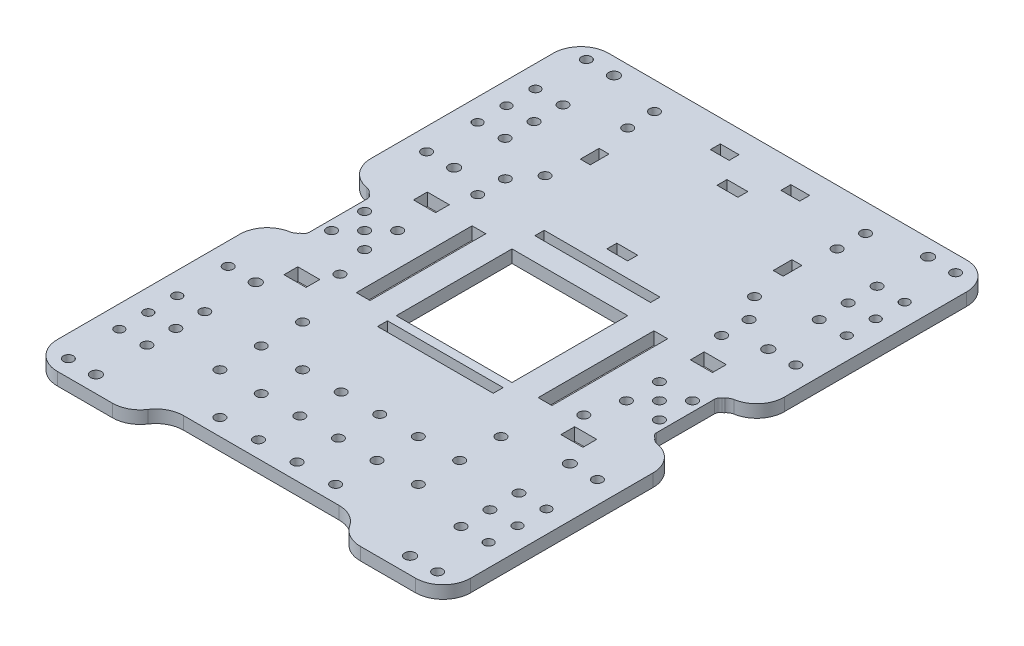
from build123d import *

# Parameters (mm, degrees)
SKETCH_2_W           = 130
SKETCH_2_H           = 200
SKETCH_2_R           = 1.8
EXTRUDE_1_DEPTH      = 4.6
FILLET_1_R           = 5
SKETCH_3_W           = 4
SKETCH_3_H           = 24
CUT_EXTRUDE_1_DEPTH  = 4.6
FILLET_2_R           = 2
FILLET_3_R           = 2
SKETCH_4_R           = 1.8
SKETCH_4_R_2         = 1.95
CUT_EXTRUDE_2_DEPTH  = 4.6
SKETCH_5_R           = 1.8
SKETCH_5_W           = 6.8
SKETCH_5_H           = 3.6
SKETCH_5_W_2         = 42
SKETCH_5_H_2         = 42
SKETCH_5_H_3         = 3.4
SKETCH_5_W_3         = 70
SKETCH_5_H_4         = 18
CUT_EXTRUDE_3_DEPTH  = 4.6
FILLET_4_R           = 10
FILLET_5_R           = 10
SKETCH_6_R           = 1.8
CUT_EXTRUDE_4_DEPTH  = 4.6
SKETCH_7_R           = 1.8
CUT_EXTRUDE_5_DEPTH  = 4.6
SKETCH_8_W           = 7.56096601
SKETCH_8_H           = 3.597038402
SKETCH_8_H_2         = 3.621629188
SKETCH_8_W_2         = 3.6
SKETCH_8_H_3         = 6.8
CUT_EXTRUDE_6_DEPTH  = 4.6
SKETCH_10_R          = 1.8
CUT_EXTRUDE_8_DEPTH  = 4.6
SKETCH_9_W           = 8
SKETCH_9_H           = 5
SKETCH_9_W_2         = 5
SKETCH_9_H_2         = 42
CUT_EXTRUDE_9_DEPTH  = 4.6
EXTRUDE_START        = 2
SKETCH_12_W          = 18.75
SKETCH_12_H          = 71.5
SKETCH_12_R          = 1.95
SKETCH_12_R_2        = 1.8
SKETCH_12_R_3        = 1.814304703
SKETCH_12_W_2        = 4
SKETCH_12_H_2        = 2
SKETCH_12_W_3        = 44.25
SKETCH_12_H_3        = 9.499668345
SKETCH_12_H_4        = 71.502072164
SKETCH_12_H_5        = 4.00066331
SKETCH_12_H_6        = 10.999668345
SKETCH_12_H_7        = 10.799999999
SKETCH_12_W_4        = 15.750000002
SKETCH_12_H_8        = 4
SKETCH_12_W_5        = 24.499999998
SKETCH_12_W_6        = 24.5
SKETCH_12_W_7        = 15.75
SKETCH_12_H_9        = 11
SKETCH_12_H_10       = 10.8
SKETCH_12_H_11       = 0.5
SKETCH_12_W_8        = 15.750000003
SKETCH_12_W_9        = 3.999999999
SKETCH_12_W_10       = 14.75
SKETCH_12_H_12       = 76.497927836
SKETCH_12_H_13       = 76.5
SKETCH_12_H_14       = 11.97
SKETCH_12_H_15       = 9.167588033
SKETCH_12_H_16       = 0.69
SKETCH_12_H_17       = 1.832411967
SKETCH_12_H_18       = 1.142411967
SKETCH_12_H_19       = 1.059701493
SKETCH_12_H_20       = 8.290597014
SKETCH_12_H_21       = 1.559701493
EXTRUDE_2_DEPTH      = 2
SKETCH_13_W          = 30
SKETCH_13_H          = 4
EXTRUDE_3_DEPTH      = 2
FILLET_6_R           = 5
SKETCH_14_W          = 42
SKETCH_14_H          = 3.4
EXTRUDE_4_DEPTH      = 4.6
SKETCH_15_W          = 42
SKETCH_15_H          = 3.6
CUT_EXTRUDE_10_DEPTH = 10
SKETCH_16_W          = 204.995685258
SKETCH_16_H          = 218.219063178
CUT_EXTRUDE_11_DEPTH = 2
SKETCH_17_W          = 15
SKETCH_17_H          = 86
EXTRUDE_5_DEPTH      = 4.6
FILLET_7_R           = 3.5
FILLET_8_R           = 10
SKETCH_18_R          = 1.7
SKETCH_18_R_2        = 1.8
CUT_EXTRUDE_12_DEPTH = 10


# Some blends are built 0.0001 mm under size
with BuildPart() as part:
    # 草图2 → 凸台-拉伸1 (new body)
    with BuildSketch(Plane(origin=(0, 0, 0), x_dir=(1, 0, 0), z_dir=(0, 1, 0))):
        Rectangle(SKETCH_2_W, SKETCH_2_H)
        with Locations(Location((-59.5, 6, 0), (0, 0, 270))):
            Circle(SKETCH_2_R, mode=Mode.SUBTRACT)
        with Locations(Location((-47.5, 6, 0), (0, 0, 270))):
            Circle(SKETCH_2_R, mode=Mode.SUBTRACT)
        with Locations(Location((-59.5, -6, 0), (0, 0, 270))):
            Circle(SKETCH_2_R, mode=Mode.SUBTRACT)
        with Locations(Location((-47.5, -6, 0), (0, 0, 270))):
            Circle(SKETCH_2_R, mode=Mode.SUBTRACT)
        with Locations(Location((-53.5, 0, 0), (0, 0, 270))):
            Circle(SKETCH_2_R, mode=Mode.SUBTRACT)
        with Locations(Location((53.5, 0, 0), (0, 0, 270))):
            Circle(SKETCH_2_R, mode=Mode.SUBTRACT)
        with Locations(Location((59.5, 6, 0), (0, 0, 270))):
            Circle(SKETCH_2_R, mode=Mode.SUBTRACT)
        with Locations(Location((59.5, -6, 0), (0, 0, 270))):
            Circle(SKETCH_2_R, mode=Mode.SUBTRACT)
        with Locations(Location((47.5, -6, 0), (0, 0, 270))):
            Circle(SKETCH_2_R, mode=Mode.SUBTRACT)
        with Locations(Location((47.5, 6, 0), (0, 0, 270))):
            Circle(SKETCH_2_R, mode=Mode.SUBTRACT)
    extrude(amount=EXTRUDE_1_DEPTH)

    # 圆角1
    fillet_1_edges = [part.edges().sort_by_distance(p)[0] for p in [
        (65, 2.3, 100),
        (-65, 2.3, 100),
        (-65, 2.3, -100),
        (65, 2.3, -100),
    ]]
    fillet(fillet_1_edges, radius=FILLET_1_R)

    # 草图3 → 切除-拉伸1 (cut)
    with BuildSketch(Plane(origin=(0, 4.6, 0), x_dir=(1, 0, 0), z_dir=(0, 1, 0))):
        with Locations((-65, 0)):
            Rectangle(SKETCH_3_W, SKETCH_3_H)
        with Locations((65, 0)):
            Rectangle(SKETCH_3_W, SKETCH_3_H)
    extrude(amount=-CUT_EXTRUDE_1_DEPTH, mode=Mode.SUBTRACT)

    # 圆角2
    fillet_2_edges = [part.edges().sort_by_distance(p)[0] for p in [
        (65, 2.3, 12),
        (65, 2.3, -12),
        (-65, 2.3, 12),
        (-65, 2.3, -12),
    ]]
    fillet(fillet_2_edges, radius=FILLET_2_R - 0.0001)  # a hair under: the kernel refuses the full size

    # 圆角3
    fillet_3_edges = [part.edges().sort_by_distance(p)[0] for p in [
        (-63, 2.3, 12),
        (-63, 2.3, -12),
        (63, 2.3, -12),
        (63, 2.3, 12),
    ]]
    fillet(fillet_3_edges, radius=FILLET_3_R)

    # 草图4 → 切除-拉伸2 (cut)
    with BuildSketch(Plane(origin=(0, 0, 0), x_dir=(1, 0, 0), z_dir=(0, 1, 0))):
        with Locations(Location((57, 65, 0), (0, 0, 270))):
            Circle(SKETCH_4_R)
        with Locations(Location((57, 75.5, 0), (0, 0, 270))):
            Circle(SKETCH_4_R)
        with Locations(Location((57, 54.5, 0), (0, 0, 270))):
            Circle(SKETCH_4_R)
        with Locations(Location((57, 94, 0), (0, 0, 270))):
            Circle(SKETCH_4_R_2)
        with Locations(Location((57, 36, 0), (0, 0, 270))):
            Circle(SKETCH_4_R_2)
        with Locations(Location((-57, 94, 0), (0, 0, 270))):
            Circle(SKETCH_4_R_2)
        with Locations(Location((-57, 75.5, 0), (0, 0, 270))):
            Circle(SKETCH_4_R)
        with Locations(Location((-57, 65, 0), (0, 0, 270))):
            Circle(SKETCH_4_R)
        with Locations(Location((-57, 54.5, 0), (0, 0, 270))):
            Circle(SKETCH_4_R)
        with Locations(Location((-57, 36, 0), (0, 0, 270))):
            Circle(SKETCH_4_R_2)
        with Locations(Location((-57, -36, 0), (0, 0, 270))):
            Circle(SKETCH_4_R_2)
        with Locations(Location((-57, -65, 0), (0, 0, 270))):
            Circle(SKETCH_4_R)
        with Locations(Location((-57, -54.5, 0), (0, 0, 270))):
            Circle(SKETCH_4_R)
        with Locations(Location((-57, -75.5, 0), (0, 0, 270))):
            Circle(SKETCH_4_R)
        with Locations(Location((-57, -94, 0), (0, 0, 270))):
            Circle(SKETCH_4_R_2)
        with Locations(Location((57, -65, 0), (0, 0, 270))):
            Circle(SKETCH_4_R)
        with Locations(Location((57, -75.5, 0), (0, 0, 270))):
            Circle(SKETCH_4_R)
        with Locations(Location((57, -54.5, 0), (0, 0, 270))):
            Circle(SKETCH_4_R)
        with Locations(Location((57, -36, 0), (0, 0, 270))):
            Circle(SKETCH_4_R_2)
        with Locations(Location((57, -94, 0), (0, 0, 270))):
            Circle(SKETCH_4_R_2)
    extrude(amount=CUT_EXTRUDE_2_DEPTH, mode=Mode.SUBTRACT)

    # 草图5 → 切除-拉伸3 (cut)
    with BuildSketch(Plane(origin=(0, 4.6, 0), x_dir=(1, 0, 0), z_dir=(0, 1, 0))):
        with Locations(Location((38.3, 90, 0), (0, 0, 270))):
            Circle(SKETCH_5_R)
        with Locations(Location((-38.3, 90, 0), (0, 0, 270))):
            Circle(SKETCH_5_R)
        with Locations((-12.8, 90)):
            Rectangle(SKETCH_5_W, SKETCH_5_H)
        with Locations((12.8, 90)):
            Rectangle(SKETCH_5_W, SKETCH_5_H)
        Rectangle(SKETCH_5_W_2, SKETCH_5_H_2)
        with Locations((0, 31)):
            Rectangle(SKETCH_5_W_2, SKETCH_5_H_3)
        with Locations((0, -31)):
            Rectangle(SKETCH_5_W_2, SKETCH_5_H_3)
        with Locations((0, -100)):
            Rectangle(SKETCH_5_W_3, SKETCH_5_H_4)
    extrude(amount=-CUT_EXTRUDE_3_DEPTH, mode=Mode.SUBTRACT)

    # 圆角4
    # the kernel refuses this fillet: 10 mm, written as the material it takes off along each edge
    with BuildSketch(Plane(origin=(-35, -24.874685928, 100), x_dir=(-1, 0, 0), z_dir=(0, 1, 0))) as fillet_4_piece_1:
        with BuildLine():
            CenterArc((9.949874371, -10), FILLET_4_R, 90, 84.260829523)
            Line((0, -9), (-0.198997487, -8.98))
            ThreePointArc((-0.198997487, -8.98), (-0.2, -4.5), (-0.2, 0))
            Line((-0.2, 0), (0, 0.2))
            Line((0, 0.2), (9.949874371, 0.2))
            Line((9.949874371, 0.2), (9.949874371, 0))
        make_face()
    extrude(amount=54.349371855, mode=Mode.SUBTRACT)
    with BuildSketch(Plane(origin=(35, 29.474685928, 100), x_dir=(0, 0, -1), z_dir=(0, -1, 0))) as fillet_4_piece_2:
        with BuildLine():
            CenterArc((10, 9.949874371), FILLET_4_R, 180, 84.260829523)
            Line((0, 9.949874371), (-0.2, 9.949874371))
            Line((-0.2, 9.949874371), (-0.2, 0))
            Line((-0.2, 0), (0, -0.2))
            ThreePointArc((0, -0.2), (4.5, -0.2), (8.98, -0.198997487))
            Line((8.98, -0.198997487), (9, 0))
        make_face()
    extrude(amount=54.349371855, mode=Mode.SUBTRACT)

    # 圆角5
    fillet_5_edges = [part.edges().sort_by_distance(p)[0] for p in [
        (35, 2.3, 91),
        (-35, 2.3, 91),
    ]]
    fillet(fillet_5_edges, radius=FILLET_5_R)

    # 草图6 → 切除-拉伸4 (cut)
    with BuildSketch(Plane(origin=(0, 4.6, 0), x_dir=(1, 0, 0), z_dir=(0, 1, 0))):
        with Locations(Location((-7, -85, 0), (0, 0, 270))):
            Circle(SKETCH_6_R)
        with Locations(Location((-21, -85, 0), (0, 0, 270))):
            Circle(SKETCH_6_R)
        with Locations(Location((7, -85, 0), (0, 0, 270))):
            Circle(SKETCH_6_R)
        with Locations(Location((21, -85, 0), (0, 0, 270))):
            Circle(SKETCH_6_R)
        with Locations(Location((21, -70, 0), (0, 0, 270))):
            Circle(SKETCH_6_R)
        with Locations(Location((7, -70, 0), (0, 0, 270))):
            Circle(SKETCH_6_R)
        with Locations(Location((-7, -70, 0), (0, 0, 270))):
            Circle(SKETCH_6_R)
        with Locations(Location((-21, -70, 0), (0, 0, 270))):
            Circle(SKETCH_6_R)
        with Locations(Location((-21, -55, 0), (0, 0, 270))):
            Circle(SKETCH_6_R)
        with Locations(Location((-7, -55, 0), (0, 0, 270))):
            Circle(SKETCH_6_R)
        with Locations(Location((7, -55, 0), (0, 0, 270))):
            Circle(SKETCH_6_R)
        with Locations(Location((21, -55, 0), (0, 0, 270))):
            Circle(SKETCH_6_R)
        with Locations(Location((36, -70, 0), (0, 0, 270))):
            Circle(SKETCH_6_R)
        with Locations(Location((36, -55, 0), (0, 0, 270))):
            Circle(SKETCH_6_R)
        with Locations(Location((36, -40, 0), (0, 0, 270))):
            Circle(SKETCH_6_R)
        with Locations(Location((-36, -40, 0), (0, 0, 270))):
            Circle(SKETCH_6_R)
        with Locations(Location((-36, -55, 0), (0, 0, 270))):
            Circle(SKETCH_6_R)
        with Locations(Location((-36, -70, 0), (0, 0, 270))):
            Circle(SKETCH_6_R)
    extrude(amount=-CUT_EXTRUDE_4_DEPTH, mode=Mode.SUBTRACT)

    # 草图7 → 切除-拉伸5 (cut)
    with BuildSketch(Plane(origin=(0, 4.6, 0), x_dir=(1, 0, 0), z_dir=(0, 1, 0))):
        with Locations(Location((-38, 80, 0), (0, 0, 270))):
            Circle(SKETCH_7_R)
        with Locations(Location((38, 80, 0), (0, 0, 270))):
            Circle(SKETCH_7_R)
        with Locations(Location((38, 50, 0), (0, 0, 270))):
            Circle(SKETCH_7_R)
        with Locations(Location((-38, 50, 0), (0, 0, 270))):
            Circle(SKETCH_7_R)
    extrude(amount=-CUT_EXTRUDE_5_DEPTH, mode=Mode.SUBTRACT)

    # 草图8 → 切除-拉伸6 (cut)
    with BuildSketch(Plane(origin=(0, 4.6, 0), x_dir=(1, 0, 0), z_dir=(0, 1, 0))):
        with Locations((0, 80)):
            Rectangle(SKETCH_8_W, SKETCH_8_H)
        with Locations((0, 40)):
            Rectangle(SKETCH_8_W, SKETCH_8_H_2)
        with Locations((35, 65)):
            Rectangle(SKETCH_8_W_2, SKETCH_8_H_3)
        with Locations((-35, 65)):
            Rectangle(SKETCH_8_W_2, SKETCH_8_H_3)
    extrude(amount=-CUT_EXTRUDE_6_DEPTH, mode=Mode.SUBTRACT)

    # 草图10 → 切除-拉伸8 (cut)
    with BuildSketch(Plane(origin=(0, 4.6, 0), x_dir=(1, 0, 0), z_dir=(0, 1, 0))):
        with Locations(Location((44.25, 41.8, 0), (0, 0, 270))):
            Circle(SKETCH_10_R)
        with Locations(Location((-44.25, 41.810125838, 0), (0, 0, 270))):
            Circle(SKETCH_10_R)
        with Locations(Location((-44.25, -18.189874162, 0), (0, 0, 270))):
            Circle(SKETCH_10_R)
        with Locations(Location((44.25, -18.2, 0), (0, 0, 270))):
            Circle(SKETCH_10_R)
        with Locations(Location((-44.25, 31.810125838, 0), (0, 0, 270))):
            Circle(SKETCH_10_R)
        with Locations(Location((44.25, 31.810125838, 0), (0, 0, 270))):
            Circle(SKETCH_10_R)
    extrude(amount=-CUT_EXTRUDE_8_DEPTH, mode=Mode.SUBTRACT)

    # 草图9 → 切除-拉伸9 (cut)
    with BuildSketch(Plane(origin=(0, 4.6, 0), x_dir=(1, 0, 0), z_dir=(0, 1, 0))):
        with Locations((-50.25, 21)):
            Rectangle(SKETCH_9_W, SKETCH_9_H)
        with Locations((50.25, 21)):
            Rectangle(SKETCH_9_W, SKETCH_9_H)
        with Locations((-50.25, -26)):
            Rectangle(SKETCH_9_W, SKETCH_9_H)
        with Locations((50.25, -26)):
            Rectangle(SKETCH_9_W, SKETCH_9_H)
        with Locations((33, 0)):
            Rectangle(SKETCH_9_W_2, SKETCH_9_H_2)
        with Locations((-33, 0)):
            Rectangle(SKETCH_9_W_2, SKETCH_9_H_2)
    extrude(amount=-CUT_EXTRUDE_9_DEPTH, mode=Mode.SUBTRACT)

    # 草图12 → 凸台-拉伸2 (add)
    # profile 1 of 46: a face of its own
    with BuildSketch(Plane.XZ.offset(EXTRUDE_START)):
        with Locations((-55.625, 64.25)):
            Rectangle(SKETCH_12_W, SKETCH_12_H)
        with Locations(Location((-57, 36, 0), (0, 0, 270))):
            Circle(SKETCH_12_R, mode=Mode.SUBTRACT)
        with Locations(Location((-57, 54.5, 0), (0, 0, 270))):
            Circle(SKETCH_12_R_2, mode=Mode.SUBTRACT)
        with Locations(Location((-57, 65, 0), (0, 0, 270))):
            Circle(SKETCH_12_R_3, mode=Mode.SUBTRACT)
        with Locations(Location((-57, 75.5, 0), (0, 0, 270))):
            Circle(SKETCH_12_R_2, mode=Mode.SUBTRACT)
        with Locations(Location((-57, 94, 0), (0, 0, 270))):
            Circle(SKETCH_12_R, mode=Mode.SUBTRACT)
    # profile 2 of 46: a face of its own
    with BuildSketch(Plane.XZ.offset(EXTRUDE_START)):
        with Locations((0, 90)):
            Rectangle(SKETCH_12_W_2, SKETCH_12_H_2)
    # profile 3 of 46: a face of its own
    with BuildSketch(Plane.XZ.offset(EXTRUDE_START)):
        with Locations((24.125, 90)):
            Rectangle(SKETCH_12_W_3, SKETCH_12_H_2)
    # profile 4 of 46: a face of its own
    with BuildSketch(Plane.XZ.offset(EXTRUDE_START)):
        with Locations((-24.125, 90)):
            Rectangle(SKETCH_12_W_3, SKETCH_12_H_2)
    # profile 5 of 46: a face of its own
    with BuildSketch(Plane.XZ.offset(EXTRUDE_START)):
        with Locations((0, 84.250165828)):
            Rectangle(SKETCH_12_W_2, SKETCH_12_H_3)
    # profile 6 of 46: a face of its own
    with BuildSketch(Plane.XZ.offset(EXTRUDE_START)):
        with Locations((55.625, 64.251036082)):
            Rectangle(SKETCH_12_W, SKETCH_12_H_4)
        with Locations(Location((57, 36, 0), (0, 0, 270))):
            Circle(SKETCH_12_R, mode=Mode.SUBTRACT)
        with Locations(Location((57, 54.5, 0), (0, 0, 270))):
            Circle(SKETCH_12_R_2, mode=Mode.SUBTRACT)
        with Locations(Location((57, 65, 0), (0, 0, 270))):
            Circle(SKETCH_12_R_2, mode=Mode.SUBTRACT)
        with Locations(Location((57, 75.5, 0), (0, 0, 270))):
            Circle(SKETCH_12_R_2, mode=Mode.SUBTRACT)
        with Locations(Location((57, 94, 0), (0, 0, 270))):
            Circle(SKETCH_12_R, mode=Mode.SUBTRACT)
    # profile 7 of 46: a face of its own
    with BuildSketch(Plane.XZ.offset(EXTRUDE_START)):
        with Locations((24.125, 77.5)):
            Rectangle(SKETCH_12_W_3, SKETCH_12_H_5)
    # profile 8 of 46: a face of its own
    with BuildSketch(Plane.XZ.offset(EXTRUDE_START)):
        with Locations((0, 77.5)):
            Rectangle(SKETCH_12_W_2, SKETCH_12_H_5)
    # profile 9 of 46: a face of its own
    with BuildSketch(Plane.XZ.offset(EXTRUDE_START)):
        with Locations((-24.125, 77.5)):
            Rectangle(SKETCH_12_W_3, SKETCH_12_H_5)
    # profile 10 of 46: a face of its own
    with BuildSketch(Plane.XZ.offset(EXTRUDE_START)):
        with Locations((0, 69.999834173)):
            Rectangle(SKETCH_12_W_2, SKETCH_12_H_6)
    # profile 11 of 46: a face of its own
    with BuildSketch(Plane.XZ.offset(EXTRUDE_START)):
        with Locations((28.5, 69.9)):
            Rectangle(SKETCH_12_W_2, SKETCH_12_H_7)
    # profile 12 of 46: a face of its own
    with BuildSketch(Plane.XZ.offset(EXTRUDE_START)):
        with Locations((-28.499999998, 69.9)):
            Rectangle(SKETCH_12_W_2, SKETCH_12_H_7)
    # profile 13 of 46: a face of its own
    with BuildSketch(Plane.XZ.offset(EXTRUDE_START)):
        with Locations((-38.374999999, 62.5)):
            Rectangle(SKETCH_12_W_4, SKETCH_12_H_8)
    # profile 14 of 46: a face of its own
    with BuildSketch(Plane.XZ.offset(EXTRUDE_START)):
        with Locations((-28.499999998, 62.5)):
            Rectangle(SKETCH_12_W_2, SKETCH_12_H_8)
    # profile 15 of 46: a face of its own
    with BuildSketch(Plane.XZ.offset(EXTRUDE_START)):
        with Locations((-14.249999999, 62.5)):
            Rectangle(SKETCH_12_W_5, SKETCH_12_H_8)
    # profile 16 of 46: a face of its own
    with BuildSketch(Plane.XZ.offset(EXTRUDE_START)):
        with Locations((0, 62.5)):
            Rectangle(SKETCH_12_W_2, SKETCH_12_H_8)
    # profile 17 of 46: a face of its own
    with BuildSketch(Plane.XZ.offset(EXTRUDE_START)):
        with Locations((14.25, 62.5)):
            Rectangle(SKETCH_12_W_6, SKETCH_12_H_8)
    # profile 18 of 46: a face of its own
    with BuildSketch(Plane.XZ.offset(EXTRUDE_START)):
        with Locations((28.5, 62.5)):
            Rectangle(SKETCH_12_W_2, SKETCH_12_H_8)
    # profile 19 of 46: a face of its own
    with BuildSketch(Plane.XZ.offset(EXTRUDE_START)):
        with Locations((38.375, 62.5)):
            Rectangle(SKETCH_12_W_7, SKETCH_12_H_8)
    # profile 20 of 46: a face of its own
    with BuildSketch(Plane.XZ.offset(EXTRUDE_START)):
        with Locations((28.5, 55)):
            Rectangle(SKETCH_12_W_2, SKETCH_12_H_9)
    # profile 21 of 46: a face of its own
    with BuildSketch(Plane.XZ.offset(EXTRUDE_START)):
        with Locations((38.375, 47.5)):
            Rectangle(SKETCH_12_W_7, SKETCH_12_H_8)
    # profile 22 of 46: a face of its own
    with BuildSketch(Plane.XZ.offset(EXTRUDE_START)):
        with Locations((28.5, 40.1)):
            Rectangle(SKETCH_12_W_2, SKETCH_12_H_10)
    # profile 23 of 46: a face of its own
    with BuildSketch(Plane.XZ.offset(EXTRUDE_START)):
        Polygon((-46.25, 34.7), (-46.25, 32.7), (46.25, 32.7), (46.25, 34.7), (30.5, 34.7), (26.5, 34.7), (-26.499999999, 34.7), (-30.499999997, 34.7), align=None)
    # profile 24 of 46: a face of its own
    with BuildSketch(Plane.XZ.offset(EXTRUDE_START)):
        with Locations((28.5, 47.5)):
            Rectangle(SKETCH_12_W_2, SKETCH_12_H_8)
    # profile 25 of 46: a face of its own
    with BuildSketch(Plane.XZ.offset(EXTRUDE_START)):
        Polygon((-26.499999998, 49.5), (-26.499999998, 45.5), (26.5, 45.5), (26.5, 49.5), (2, 49.5), (2, 49), (-2, 49), (-2, 49.5), align=None)
    # profile 26 of 46: a face of its own
    with BuildSketch(Plane.XZ.offset(EXTRUDE_START)):
        with Locations((0, 55)):
            Rectangle(SKETCH_12_W_2, SKETCH_12_H_9)
    # profile 27 of 46: a face of its own
    with BuildSketch(Plane.XZ.offset(EXTRUDE_START)):
        with Locations((0, 49.25)):
            Rectangle(SKETCH_12_W_2, SKETCH_12_H_11)
    # profile 28 of 46: a face of its own
    with BuildSketch(Plane.XZ.offset(EXTRUDE_START)):
        Polygon((-30.499999998, 60.5), (-30.499999997, 49.5), (-26.499999998, 49.5), (-26.499999998, 60.5), align=None)
    # profile 29 of 46: a face of its own
    with BuildSketch(Plane.XZ.offset(EXTRUDE_START)):
        with Locations((-38.374999999, 47.5)):
            Rectangle(SKETCH_12_W_8, SKETCH_12_H_8)
    # profile 30 of 46: a face of its own
    with BuildSketch(Plane.XZ.offset(EXTRUDE_START)):
        with Locations((-28.499999998, 47.5)):
            Rectangle(SKETCH_12_W_9, SKETCH_12_H_8)
    # profile 31 of 46: a face of its own
    with BuildSketch(Plane.XZ.offset(EXTRUDE_START)):
        Polygon((-30.499999997, 45.5), (-30.499999997, 34.699999999), (-26.499999999, 34.7), (-26.499999998, 45.5), align=None)
    # profile 32 of 46: a face of its own
    with BuildSketch(Plane.XZ.offset(EXTRUDE_START)):
        with Locations((57.625, -61.748963918)):
            Rectangle(SKETCH_12_W_10, SKETCH_12_H_12)
        with Locations(Location((57, -94, 0), (0, 0, 270))):
            Circle(SKETCH_12_R, mode=Mode.SUBTRACT)
        with Locations(Location((57, -75.5, 0), (0, 0, 270))):
            Circle(SKETCH_12_R_2, mode=Mode.SUBTRACT)
        with Locations(Location((57, -65, 0), (0, 0, 270))):
            Circle(SKETCH_12_R_2, mode=Mode.SUBTRACT)
        with Locations(Location((57, -54.5, 0), (0, 0, 270))):
            Circle(SKETCH_12_R_2, mode=Mode.SUBTRACT)
        with Locations(Location((57, -36, 0), (0, 0, 270))):
            Circle(SKETCH_12_R, mode=Mode.SUBTRACT)
    # profile 33 of 46: a face of its own
    with BuildSketch(Plane.XZ.offset(EXTRUDE_START)):
        with Locations((-57.625, -61.75)):
            Rectangle(SKETCH_12_W_10, SKETCH_12_H_13)
        with Locations(Location((-57, -36, 0), (0, 0, 270))):
            Circle(SKETCH_12_R, mode=Mode.SUBTRACT)
        with Locations(Location((-57, -54.5, 0), (0, 0, 270))):
            Circle(SKETCH_12_R_2, mode=Mode.SUBTRACT)
        with Locations(Location((-57, -65, 0), (0, 0, 270))):
            Circle(SKETCH_12_R_2, mode=Mode.SUBTRACT)
        with Locations(Location((-57, -75.5, 0), (0, 0, 270))):
            Circle(SKETCH_12_R_2, mode=Mode.SUBTRACT)
        with Locations(Location((-57, -94, 0), (0, 0, 270))):
            Circle(SKETCH_12_R, mode=Mode.SUBTRACT)
    # profile 34 of 46: a face of its own
    with BuildSketch(Plane.XZ.offset(EXTRUDE_START)):
        Polygon((50.25, -54.875), (-50.25, -54.875), (-50.25, -58.875), (-2, -58.875), (2, -58.875), (50.25, -58.875), align=None)
    # profile 35 of 46: a face of its own
    with BuildSketch(Plane.XZ.offset(EXTRUDE_START)):
        with Locations((0, -64.86)):
            Rectangle(SKETCH_12_W_2, SKETCH_12_H_14)
    # profile 36 of 46: a face of its own
    with BuildSketch(Plane.XZ.offset(EXTRUDE_START)):
        Polygon((-2, -70.845), (-50.25, -70.845), (-50.25, -74.845), (-21.990241502, -74.845), (-21.990241502, -74.155), (-17.990241502, -74.155), (-17.990241502, -74.845), (17.990241502, -74.845), (21.990241502, -74.845), (50.25, -74.845), (50.25, -70.845), (2, -70.845), align=None)
    # profile 37 of 46: a face of its own
    with BuildSketch(Plane.XZ.offset(EXTRUDE_START)):
        with Locations((19.990241502, -79.428794017)):
            Rectangle(SKETCH_12_W_2, SKETCH_12_H_15)
    # profile 38 of 46: a face of its own
    with BuildSketch(Plane.XZ.offset(EXTRUDE_START)):
        with Locations((-19.990241502, -79.428794017)):
            Rectangle(SKETCH_12_W_2, SKETCH_12_H_15)
    # profile 39 of 46: a face of its own
    with BuildSketch(Plane.XZ.offset(EXTRUDE_START)):
        with Locations((-19.990241502, -74.5)):
            Rectangle(SKETCH_12_W_2, SKETCH_12_H_16)
    # profile 40 of 46: a face of its own
    with BuildSketch(Plane.XZ.offset(EXTRUDE_START)):
        Polygon((-50.25, -84.012588033), (-50.25, -86.012588033), (-2, -86.012588033), (-2, -84.95288654), (2, -84.95288654), (2, -86.012588033), (50.25, -86.012588033), (50.25, -84.012588033), (21.990241502, -84.012588033), (21.990241502, -85.155), (17.990241502, -85.155), (17.990241502, -84.012588033), (-17.990241502, -84.012588033), (-17.990241502, -85.845), (-21.990241502, -85.845), (-21.990241502, -84.012588033), align=None)
    # profile 41 of 46: a face of its own
    with BuildSketch(Plane.XZ.offset(EXTRUDE_START)):
        with Locations((-19.990241502, -84.928794017)):
            Rectangle(SKETCH_12_W_2, SKETCH_12_H_17)
    # profile 42 of 46: a face of its own
    with BuildSketch(Plane.XZ.offset(EXTRUDE_START)):
        with Locations((19.990241502, -84.583794017)):
            Rectangle(SKETCH_12_W_2, SKETCH_12_H_18)
    # profile 43 of 46: a face of its own
    with BuildSketch(Plane.XZ.offset(EXTRUDE_START)):
        with Locations((0, -85.482737286)):
            Rectangle(SKETCH_12_W_2, SKETCH_12_H_19)
    # profile 44 of 46: a face of its own
    with BuildSketch(Plane.XZ.offset(EXTRUDE_START)):
        with Locations((0, -90.15788654)):
            Rectangle(SKETCH_12_W_2, SKETCH_12_H_20)
    # profile 45 of 46: a face of its own
    with BuildSketch(Plane.XZ.offset(EXTRUDE_START)):
        Polygon((-50.25, -94.303185047), (-50.25, -97.303185047), (50.25, -97.303185047), (50.25, -94.303185047), (2, -94.303185047), (2, -95.86288654), (-2, -95.86288654), (-2, -94.303185047), align=None)
    # profile 46 of 46: a face of its own
    with BuildSketch(Plane.XZ.offset(EXTRUDE_START)):
        with Locations((0, -95.083035794)):
            Rectangle(SKETCH_12_W_2, SKETCH_12_H_21)
    extrude(amount=-EXTRUDE_2_DEPTH)

    # 草图13 → 凸台-拉伸3 (add)
    with BuildSketch(Plane.XZ):
        with Locations((0, -43.810814594)):
            Rectangle(SKETCH_13_W, SKETCH_13_H)
    extrude(amount=EXTRUDE_3_DEPTH)

    # 圆角6
    # the kernel refuses this fillet: 5 mm, written as the material it takes off along each edge
    with BuildSketch(Plane(origin=(-65, -2, -100), x_dir=(0, 0, 1), z_dir=(0, 1, 0)), Plane(origin=(-65, -2, 100), x_dir=(1, 0, 0), z_dir=(0, 1, 0)), Plane(origin=(65, -2, 100.002072164), x_dir=(0, 0, -1), z_dir=(0, 1, 0))) as fillet_6_piece_1:
        with BuildLine():
            CenterArc((FILLET_6_R, FILLET_6_R), FILLET_6_R, 180, 90)
            Line((0, FILLET_6_R), (-FILLET_6_R * 0.02, FILLET_6_R))
            Line((-FILLET_6_R * 0.02, FILLET_6_R), (-FILLET_6_R * 0.02, -FILLET_6_R * 0.02))
            Line((-FILLET_6_R * 0.02, -FILLET_6_R * 0.02), (FILLET_6_R, -FILLET_6_R * 0.02))
            Line((FILLET_6_R, -FILLET_6_R * 0.02), (FILLET_6_R, 0))
        make_face()
    extrude(amount=2, mode=Mode.SUBTRACT)
    with BuildSketch(Plane(origin=(65, -2, -99.997927836), x_dir=(0, 0, 1), z_dir=(0, 1, 0))) as fillet_6_piece_2:
        with BuildLine():
            CenterArc((FILLET_6_R, -FILLET_6_R), FILLET_6_R, 90, 90)
            Line((0, -FILLET_6_R), (-FILLET_6_R * 0.02, -FILLET_6_R))
            Line((-FILLET_6_R * 0.02, -FILLET_6_R), (-FILLET_6_R * 0.02, FILLET_6_R * 0.02))
            Line((-FILLET_6_R * 0.02, FILLET_6_R * 0.02), (FILLET_6_R, FILLET_6_R * 0.02))
            Line((FILLET_6_R, FILLET_6_R * 0.02), (FILLET_6_R, 0))
        make_face()
    extrude(amount=2, mode=Mode.SUBTRACT)

    # 草图14 → 凸台-拉伸4 (add)
    with BuildSketch(Plane(origin=(0, 4.6, 0), x_dir=(1, 0, 0), z_dir=(0, 1, 0))):
        with Locations((0, -31)):
            Rectangle(SKETCH_14_W, SKETCH_14_H)
    extrude(amount=-EXTRUDE_4_DEPTH)

    # 草图15 → 切除-拉伸10 (cut)
    with BuildSketch(Plane(origin=(0, 4.6, 0), x_dir=(1, 0, 0), z_dir=(0, 1, 0))):
        with Locations((0, -26)):
            Rectangle(SKETCH_15_W, SKETCH_15_H)
    extrude(amount=-CUT_EXTRUDE_10_DEPTH, mode=Mode.SUBTRACT)

    # 草图16 → 切除-拉伸11 (cut)
    with BuildSketch(Plane.XZ):
        Rectangle(SKETCH_16_W, SKETCH_16_H)
    extrude(amount=CUT_EXTRUDE_11_DEPTH, mode=Mode.SUBTRACT)

    # 草图17 → 凸台-拉伸5 (add)
    with BuildSketch(Plane(origin=(0, 0, 0), x_dir=(1, 0, 0), z_dir=(0, 1, 0))):
        with Locations((-67.5, -57)):
            Rectangle(SKETCH_17_W, SKETCH_17_H)
        with Locations((67.5, -57)):
            Rectangle(SKETCH_17_W, SKETCH_17_H)
        with Locations((-67.5, 57)):
            Rectangle(SKETCH_17_W, SKETCH_17_H)
        with Locations((67.5, 57)):
            Rectangle(SKETCH_17_W, SKETCH_17_H)
    extrude(amount=EXTRUDE_5_DEPTH)

    # 圆角7
    fillet_7_edges = [part.edges().sort_by_distance(p)[0] for p in [
        (65, 2.3, 14),
        (65, 2.3, -14),
        (-65, 2.3, 14),
        (-65, 2.3, -14),
    ]]
    fillet(fillet_7_edges, radius=FILLET_7_R)

    # 圆角8
    fillet_8_edges = [part.edges().sort_by_distance(p)[0] for p in [
        (75, 2.3, -100),
        (-75, 2.3, -100),
        (-75, 2.3, -14),
        (-75, 2.3, 14),
        (-75, 2.3, 100),
        (75, 2.3, 100),
        (75, 2.3, -14),
        (75, 2.3, 14),
    ]]
    fillet(fillet_8_edges, radius=FILLET_8_R)

    # 草图18 → 切除-拉伸12 (cut)
    with BuildSketch(Plane(origin=(0, 4.6, 0), x_dir=(1, 0, 0), z_dir=(0, 1, 0))):
        with Locations(Location((67, 75.5, 0), (0, 0, 270))):
            Circle(SKETCH_18_R)
        with Locations(Location((67, 65, 0), (0, 0, 270))):
            Circle(SKETCH_18_R)
        with Locations(Location((67, 54.5, 0), (0, 0, 270))):
            Circle(SKETCH_18_R)
        with Locations(Location((67, -54.5, 0), (0, 0, 270))):
            Circle(SKETCH_18_R)
        with Locations(Location((67, -65, 0), (0, 0, 270))):
            Circle(SKETCH_18_R)
        with Locations(Location((67, -75.5, 0), (0, 0, 270))):
            Circle(SKETCH_18_R)
        with Locations(Location((-67, -75.5, 0), (0, 0, 270))):
            Circle(SKETCH_18_R)
        with Locations(Location((-67, -65, 0), (0, 0, 270))):
            Circle(SKETCH_18_R)
        with Locations(Location((-67, -54.5, 0), (0, 0, 270))):
            Circle(SKETCH_18_R)
        with Locations(Location((-67, 54.5, 0), (0, 0, 270))):
            Circle(SKETCH_18_R)
        with Locations(Location((-67, 65, 0), (0, 0, 270))):
            Circle(SKETCH_18_R)
        with Locations(Location((-67, 75.5, 0), (0, 0, 270))):
            Circle(SKETCH_18_R)
        with Locations(Location((-67, 94, 0), (0, 0, 270))):
            Circle(SKETCH_18_R_2)
        with Locations(Location((67, -94, 0), (0, 0, 270))):
            Circle(SKETCH_18_R_2)
        with Locations(Location((67, -36, 0), (0, 0, 270))):
            Circle(SKETCH_18_R_2)
        with Locations(Location((-67, -36, 0), (0, 0, 270))):
            Circle(SKETCH_18_R_2)
        with Locations(Location((-67, -94, 0), (0, 0, 270))):
            Circle(SKETCH_18_R_2)
        with Locations(Location((-67, 36, 0), (0, 0, 270))):
            Circle(SKETCH_18_R_2)
        with Locations(Location((67, 36, 0), (0, 0, 270))):
            Circle(SKETCH_18_R_2)
        with Locations(Location((67, 94, 0), (0, 0, 270))):
            Circle(SKETCH_18_R_2)
    extrude(amount=-CUT_EXTRUDE_12_DEPTH, mode=Mode.SUBTRACT)


solid = part.part
